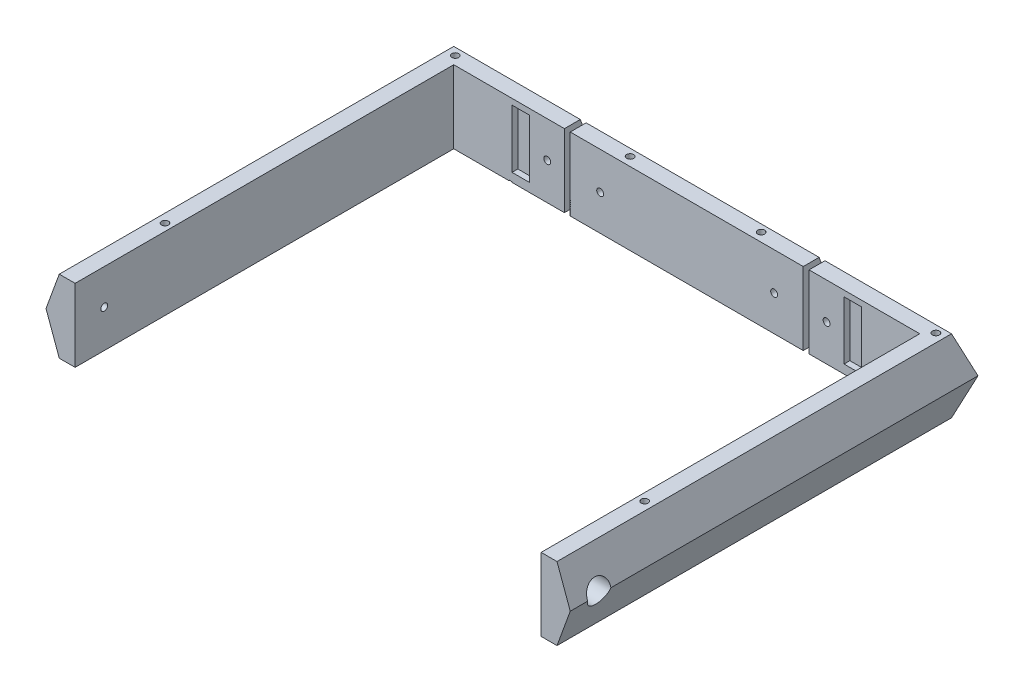
from build123d import *

# Parameters (mm, degrees)
BOSS_EXTRUDE1_DEPTH            = 31.75
SKETCH2_W                      = 1.348886442
SKETCH2_H                      = 0.254
CUT_EXTRUDE1_DEPTH             = 2.54
SKETCH19_W                     = 7.62
SKETCH19_H                     = 25.4
CUT_EXTRUDE5_DEPTH             = 2.54
SKETCH3_W                      = 101.6
SKETCH3_H                      = 12.7
BOSS_EXTRUDE2_DEPTH            = 31.75
CHAMFER4_SIZE                  = 15.875
CHAMFER4_SIZE2                 = 5.778027469
CHAMFER5_SIZE                  = 15.875
CHAMFER5_SIZE_2                = 5.778027469
CHAMFER6_SIZE                  = 15.875
CHAMFER6_SIZE2                 = 5.778027469
CHAMFER7_SIZE                  = 15.875
CHAMFER7_SIZE_2                = 5.778027469
CHAMFER8_SIZE                  = 15.875
CHAMFER8_SIZE2                 = 5.778027469
CHAMFER9_SIZE                  = 15.875
CHAMFER9_SIZE_2                = 5.778027469
CHAMFER10_SIZE                 = 15.875
CHAMFER10_SIZE2                = 5.778027469
CHAMFER11_SIZE2                = 5.778027469
CHAMFER11_SIZE                 = 15.875
CHAMFER12_SIZE                 = 15.875
CHAMFER12_SIZE2                = 5.778027469
CHAMFER13_SIZE2                = 5.778027469
CHAMFER13_SIZE                 = 15.875
CUT_EXTRUDE2_START             = 2.54
SKETCH4_R                      = 5.08
CUT_EXTRUDE2_DEPTH             = 25.4
CUT_EXTRUDE3_START             = 2.54
SKETCH5_R                      = 5.147895679
SKETCH5_R_2                    = 5.08
CUT_EXTRUDE3_DEPTH             = 25.4
CUT_EXTRUDE4_START             = -2.54
SKETCH6_R                      = 5.08
CUT_EXTRUDE4_DEPTH             = 12.7
F_3_0MM_DOWEL_HOLE3_AT_2_COUNT = 2
F_3_0MM_DOWEL_HOLE3_AT_2_PITCH = 23.068947374
F_3_0MM_START                  = -2.54
F_3_0MM_DOWEL_HOLE4_OUTLINE_R  = 1.5
F_3_0MM_DOWEL_HOLE4_DEPTH      = 2.54


# Read off the part's stored shape, not the designer's step: Ø3.0mm Dowel Hole4, Ø3.0mm Dowel Hole5, Ø3.0mm Dowel Hole6
# Some blends are built 0.0001 mm under size
with BuildPart() as part:
    # Sketch1 → Boss-Extrude1 (new body)
    with BuildSketch(Plane(origin=(0, 0, 0), x_dir=(1, 0, 0), z_dir=(0, 1, 0))):
        Polygon((-101.6, 0), (-101.6, -165.1), (-114.3, -165.1), (-114.3, 12.7), (-53.34, 12.7), (-53.34, 0), align=None)
    extrude(amount=BOSS_EXTRUDE1_DEPTH)

    # Sketch2 → Cut-Extrude1 (cut)
    with BuildSketch(Plane.XY):
        with Locations((-76.874443221, 0.127)):
            Rectangle(SKETCH2_W, SKETCH2_H)
    extrude(amount=-CUT_EXTRUDE1_DEPTH, mode=Mode.SUBTRACT)


with BuildPart() as body_2:
    # Mirror4: mirrored copy
    add(part.part.mirror(Plane(origin=(0, 0, 0), x_dir=(0, 0, 1), z_dir=(1, 0, 0))))

    # Sketch19 → Cut-Extrude5 (cut)
    with BuildSketch(Plane.XY):
        with Locations((72.39, 16.51)):
            Rectangle(SKETCH19_W, SKETCH19_H)
    cut_extrude5 = extrude(amount=-CUT_EXTRUDE5_DEPTH, mode=Mode.SUBTRACT)

    # Chamfer8
    chamfer8_edges = [body_2.edges().sort_by_distance(p)[0] for p in [
        (114.3, 31.75, 76.2),
    ]]
    chamfer8_side = [body_2.faces().sort_by_distance(p)[0] for p in [
        (114.3, 15.875, 76.2),
    ]]
    chamfer(chamfer8_edges, length=CHAMFER8_SIZE, length2=CHAMFER8_SIZE2, reference=chamfer8_side[0])

    # Chamfer9
    # the kernel refuses this chamfer: 15.875, 5.778027469 mm, written as the material it takes off along each edge
    with BuildSketch(Plane(origin=(114.3, 0, 206.282841379), x_dir=(0.013184058198645545, 0.9999130865277317, 0), z_dir=(0, 0, -1))) as chamfer9_piece_1:
        Polygon((CHAMFER9_SIZE * 0.999913086528, -CHAMFER9_SIZE * 0.0131840581986), (-CHAMFER9_SIZE_2 * 0.0131840581986, -CHAMFER9_SIZE_2 * 0.999913086524), (0, 0), align=None)
    extrude(amount=260.165682758, mode=Mode.SUBTRACT)

    # Chamfer10
    chamfer10_edges = [body_2.edges().sort_by_distance(p)[0] for p in [
        (80.930986266, 31.75, -12.7),
    ]]
    chamfer10_side = [body_2.faces().sort_by_distance(p)[0] for p in [
        (82.399447724, 15.875, -12.7),
    ]]
    chamfer(chamfer10_edges, length=CHAMFER10_SIZE, length2=CHAMFER10_SIZE2, reference=chamfer10_side[0])

    # Chamfer11
    chamfer11_edges = [body_2.edges().sort_by_distance(p)[0] for p in [
        (80.930986266, 0, -12.7),
    ]]
    chamfer11_side = [body_2.faces().sort_by_distance(p)[0] for p in [
        (80.930986266, 0.115560549, -12.7),
    ]]
    chamfer(chamfer11_edges, length=CHAMFER11_SIZE - 0.0001, length2=CHAMFER11_SIZE2 - 0.0001, reference=chamfer11_side[0])  # a hair under: the kernel refuses the full size

    # Sketch4 → Cut-Extrude2 (cut)
    with BuildSketch(Plane(origin=(-76.2, 0, 0), x_dir=(-1, 0, 0), z_dir=(0, 0, -1)).offset(CUT_EXTRUDE2_START)):
        with Locations((-137.16, 15.875)):
            Circle(SKETCH4_R)
    cut_extrude2 = extrude(amount=CUT_EXTRUDE2_DEPTH, mode=Mode.SUBTRACT)

    # Sketch6 → Cut-Extrude4 (cut)
    with BuildSketch(Plane.ZY.offset(-101.6).offset(CUT_EXTRUDE4_START)):
        with Locations((152.4, 16.401907221)):
            Circle(SKETCH6_R)
    cut_extrude4 = extrude(amount=-CUT_EXTRUDE4_DEPTH, mode=Mode.SUBTRACT)

    # Sketch8 → Hole Wizard 2736 (revolve, cut)
    with BuildSketch(Plane(origin=(104.14, 16.401907221, 152.4), x_dir=(0, 0, -1), z_dir=(0, 1, 0))):
        Polygon((0, 0), (0, 8.521290929), (1.5, 7.62), (1.5, 0), align=None)
    revolve(axis=Axis((110.49, 16.401907221, 152.4), (-1, 0, 0)), mode=Mode.SUBTRACT)

    # Sketch12 → Ø3.0mm Dowel Hole1 (revolve, cut)
    with BuildSketch(Plane(origin=(60.96, 15.875, -2.54), x_dir=(0, 1, 0), z_dir=(1, 0, 0))):
        Polygon((0, 0), (0, 5.981290929), (1.5, 5.08), (1.5, 0), align=None)
    revolve(axis=Axis((60.96, 15.875, -8.89), (0, 0, 1)), mode=Mode.SUBTRACT)

    # 3.0mm Dowel Hole5 3 outline → 3.0mm Dowel Hole5 3 (revolve, cut)
    with BuildSketch(Plane(origin=(104.838027469, 0, -3.81), x_dir=(1, 0, 0), z_dir=(0, 0, 1))):
        Polygon((0, 31.75), (0, 27.356209071), (1.5, 28.2575), (1.5, 31.75), align=None)
    revolve(axis=Axis((104.838027469, 0, -3.81), (0, 1, 0)), mode=Mode.SUBTRACT)

    # 3.0mm Dowel Hole5 4 outline → 3.0mm Dowel Hole5 4 (revolve, cut)
    with BuildSketch(Plane(origin=(104.838027469, 0, 123.19), x_dir=(1, 0, 0), z_dir=(0, 0, 1))):
        Polygon((0, 31.75), (0, 27.356209071), (1.5, 28.2575), (1.5, 31.75), align=None)
    revolve(axis=Axis((104.838027469, 0, 123.19), (0, 1, 0)), mode=Mode.SUBTRACT)

    # 3.0mm Dowel Hole6 3 outline → 3.0mm Dowel Hole6 3 (revolve, cut)
    with BuildSketch(Plane(origin=(104.838027469, 0, -3.111972531), x_dir=(1, 0, 0), z_dir=(0, 0, 1))):
        Polygon((1.5, 0), (1.5, 3.4925), (0, 4.393790929), (0, 0), align=None)
    revolve(axis=Axis((104.838027469, 0, -3.111972531), (0, 1, 0)), mode=Mode.SUBTRACT)

    # 3.0mm Dowel Hole6 4 outline → 3.0mm Dowel Hole6 4 (revolve, cut)
    with BuildSketch(Plane(origin=(104.838027469, 0, 123.888027469), x_dir=(1, 0, 0), z_dir=(0, 0, 1))):
        Polygon((1.5, 0), (1.5, 3.4925), (0, 4.393790929), (0, 0), align=None)
    revolve(axis=Axis((104.838027469, 0, 123.888027469), (0, 1, 0)), mode=Mode.SUBTRACT)


with BuildPart() as body_3:
    # Sketch3 → Boss-Extrude2 (new body)
    with BuildSketch(Plane(origin=(0, 0, 0), x_dir=(1, 0, 0), z_dir=(0, 1, 0))):
        with Locations((0, 6.35)):
            Rectangle(SKETCH3_W, SKETCH3_H)
    extrude(amount=BOSS_EXTRUDE2_DEPTH)

    # Chamfer4
    chamfer4_edges = [body_3.edges().sort_by_distance(p)[0] for p in [
        (0, 31.75, -12.7),
    ]]
    chamfer4_side = [body_3.faces().sort_by_distance(p)[0] for p in [
        (0, 15.875, -12.7),
    ]]
    chamfer(chamfer4_edges, length=CHAMFER4_SIZE, length2=CHAMFER4_SIZE2, reference=chamfer4_side[0])

    # Chamfer5
    # the kernel refuses this chamfer: 15.875, 5.778027469 mm, written as the material it takes off along each edge
    with BuildSketch(Plane(origin=(91.982841379, 0, -12.7), x_dir=(0, 0.9999130865277315, -0.013184058198645866), z_dir=(-1, 0, 0))) as chamfer5_piece_1:
        Polygon((CHAMFER5_SIZE * 0.999913086528, -CHAMFER5_SIZE * 0.0131840581986), (-CHAMFER5_SIZE_2 * 0.0131840581986, -CHAMFER5_SIZE_2 * 0.999913086524), (0, 0), align=None)
    extrude(amount=183.965682758, mode=Mode.SUBTRACT)

    # Sketch5 → Cut-Extrude3 (cut)
    with BuildSketch(Plane(origin=(-76.2, 0, 0), x_dir=(-1, 0, 0), z_dir=(0, 0, -1)).offset(CUT_EXTRUDE3_START)):
        with Locations(Location((-114.3, 15.363866424, 0), (0, 0, 174.301724033))):
            Circle(SKETCH5_R)
        with Locations(Location((-38.1, 15.363866424, 0), (0, 0, 174.225307714))):
            Circle(SKETCH5_R_2)
    extrude(amount=CUT_EXTRUDE3_DEPTH, mode=Mode.SUBTRACT)

    # Sketch15 → Ø3.0mm Dowel Hole3 (revolve, cut)
    with BuildSketch(Plane(origin=(-37.760805084, 15.502033877, -2.54), x_dir=(0, 1, 0), z_dir=(1, 0, 0))):
        Polygon((0, 0), (0, 13.601290929), (1.5, 12.7), (1.5, 0), align=None)
    f_3_0mm_dowel_hole3 = revolve(axis=Axis((-37.760805084, 15.502033877, -8.89), (0, 0, 1)), mode=Mode.SUBTRACT)

    # Ø3.0mm Dowel Hole4 outline → Ø3.0mm Dowel Hole4 (cut)
    with BuildSketch(Plane.XY.offset(F_3_0MM_START)):
        with Locations((38.1, 15.363866424)):
            Circle(F_3_0MM_DOWEL_HOLE4_OUTLINE_R)
    extrude(amount=F_3_0MM_DOWEL_HOLE4_DEPTH, mode=Mode.SUBTRACT)

    # Ø3.0mm Dowel Hole5 outline → Ø3.0mm Dowel Hole5 (revolve, cut)
    with BuildSketch(Plane(origin=(-28.511972531, 0, -3.81), x_dir=(1, 0, 0), z_dir=(0, 0, 1))):
        Polygon((0, 31.75), (0, 27.356209071), (1.5, 28.2575), (1.5, 31.75), align=None)
    revolve(axis=Axis((-28.511972531, 0, -3.81), (0, 1, 0)), mode=Mode.SUBTRACT)

    # 3.0mm Dowel Hole5 2 outline → 3.0mm Dowel Hole5 2 (revolve, cut)
    with BuildSketch(Plane(origin=(28.638027469, 0, -3.81), x_dir=(1, 0, 0), z_dir=(0, 0, 1))):
        Polygon((0, 31.75), (0, 27.356209071), (1.5, 28.2575), (1.5, 31.75), align=None)
    revolve(axis=Axis((28.638027469, 0, -3.81), (0, 1, 0)), mode=Mode.SUBTRACT)

    # Ø3.0mm Dowel Hole6 outline → Ø3.0mm Dowel Hole6 (revolve, cut)
    with BuildSketch(Plane(origin=(28.638027469, 0, -3.111972531), x_dir=(1, 0, 0), z_dir=(0, 0, 1))):
        Polygon((1.5, 3.4925), (0, 4.393790929), (0, 0), (1.5, 0), align=None)
    revolve(axis=Axis((28.638027469, 0, -3.111972531), (0, 1, 0)), mode=Mode.SUBTRACT)

    # 3.0mm Dowel Hole6 2 outline → 3.0mm Dowel Hole6 2 (revolve, cut)
    with BuildSketch(Plane(origin=(-28.511972531, 0, -3.111972531), x_dir=(1, 0, 0), z_dir=(0, 0, 1))):
        Polygon((1.5, 3.4925), (0, 4.393790929), (0, 0), (1.5, 0), align=None)
    revolve(axis=Axis((-28.511972531, 0, -3.111972531), (0, 1, 0)), mode=Mode.SUBTRACT)


with BuildPart() as part_1:
    add(part.part)

    # Chamfer6
    chamfer6_edges = [part_1.edges().sort_by_distance(p)[0] for p in [
        (-114.3, 31.75, 76.2),
    ]]
    chamfer6_side = [part_1.faces().sort_by_distance(p)[0] for p in [
        (-114.3, 15.875, 76.2),
    ]]
    chamfer(chamfer6_edges, length=CHAMFER6_SIZE, length2=CHAMFER6_SIZE2, reference=chamfer6_side[0])

    # Chamfer7
    # the kernel refuses this chamfer: 15.875, 5.778027469 mm, written as the material it takes off along each edge
    with BuildSketch(Plane(origin=(-114.3, 0, 206.282841379), x_dir=(-0.013184058198645545, 0.9999130865277317, 0), z_dir=(0, 0, -1))) as chamfer7_piece_1:
        Polygon((CHAMFER7_SIZE * 0.999913086528, CHAMFER7_SIZE * 0.0131840581986), (-CHAMFER7_SIZE_2 * 0.0131840581986, CHAMFER7_SIZE_2 * 0.999913086524), (0, 0), align=None)
    extrude(amount=260.165682758, mode=Mode.SUBTRACT)

    # Chamfer12
    chamfer12_edges = [part_1.edges().sort_by_distance(p)[0] for p in [
        (-80.930986266, 31.75, -12.7),
    ]]
    chamfer12_side = [part_1.faces().sort_by_distance(p)[0] for p in [
        (-82.399447724, 15.875, -12.7),
    ]]
    chamfer(chamfer12_edges, length=CHAMFER12_SIZE, length2=CHAMFER12_SIZE2, reference=chamfer12_side[0])

    # Chamfer13
    chamfer13_edges = [part_1.edges().sort_by_distance(p)[0] for p in [
        (-80.930986266, 0, -12.7),
    ]]
    chamfer13_side = [part_1.faces().sort_by_distance(p)[0] for p in [
        (-80.930986266, 0.115560549, -12.7),
    ]]
    chamfer(chamfer13_edges, length=CHAMFER13_SIZE - 0.0001, length2=CHAMFER13_SIZE2 - 0.0001, reference=chamfer13_side[0])  # a hair under: the kernel refuses the full size

    # Mirror5: Cut-Extrude2 across plane
    add(cut_extrude2.mirror(Plane(origin=(0, 0, 0), x_dir=(0, 0, 1), z_dir=(1, 0, 0))), mode=Mode.SUBTRACT)

    # Mirror7: Cut-Extrude4 across plane
    add(cut_extrude4.mirror(Plane(origin=(0, 0, 0), x_dir=(0, 0, 1), z_dir=(1, 0, 0))), mode=Mode.SUBTRACT)

    # Sketch10 → Hole Wizard 2871 (revolve, cut)
    with BuildSketch(Plane(origin=(-104.14, 16.401907221, 152.4), x_dir=(0, 0, 1), z_dir=(0, 1, 0))):
        Polygon((0, 0), (0, 8.521290929), (1.5, 7.62), (1.5, 0), align=None)
    revolve(axis=Axis((-110.49, 16.401907221, 152.4), (1, 0, 0)), mode=Mode.SUBTRACT)

    # Ø3.0mm Dowel Hole3 at 2: Ø3.0mm Dowel Hole3 ×2
    with Locations(*[Vector(-0.9997387915498553, 0.022854948489000708, 0) * (i * F_3_0MM_DOWEL_HOLE3_AT_2_PITCH) for i in range(1, F_3_0MM_DOWEL_HOLE3_AT_2_COUNT)]):
        add(f_3_0mm_dowel_hole3, mode=Mode.SUBTRACT)

    # 3.0mm Dowel Hole5 5 outline → 3.0mm Dowel Hole5 5 (revolve, cut)
    with BuildSketch(Plane(origin=(-104.741464941, 0, 122.765456434), x_dir=(1, 0, 0), z_dir=(0, 0, 1))):
        Polygon((0, 31.75), (0, 25.768709071), (1.5, 26.67), (1.5, 31.75), align=None)
    revolve(axis=Axis((-104.741464941, 0, 122.765456434), (0, 1, 0)), mode=Mode.SUBTRACT)

    # 3.0mm Dowel Hole5 6 outline → 3.0mm Dowel Hole5 6 (revolve, cut)
    with BuildSketch(Plane(origin=(-104.711972531, 0, -3.81), x_dir=(1, 0, 0), z_dir=(0, 0, 1))):
        Polygon((0, 31.75), (0, 27.356209071), (1.5, 28.2575), (1.5, 31.75), align=None)
    revolve(axis=Axis((-104.711972531, 0, -3.81), (0, 1, 0)), mode=Mode.SUBTRACT)

    # 3.0mm Dowel Hole6 5 outline → 3.0mm Dowel Hole6 5 (revolve, cut)
    with BuildSketch(Plane(origin=(-104.711972531, 0, -3.111972531), x_dir=(1, 0, 0), z_dir=(0, 0, 1))):
        Polygon((1.5, 0), (1.5, 3.4925), (0, 4.393790929), (0, 0), align=None)
    revolve(axis=Axis((-104.711972531, 0, -3.111972531), (0, 1, 0)), mode=Mode.SUBTRACT)

    # 3.0mm Dowel Hole6 6 outline → 3.0mm Dowel Hole6 6 (revolve, cut)
    with BuildSketch(Plane(origin=(-104.711972531, 0, 123.888027469), x_dir=(1, 0, 0), z_dir=(0, 0, 1))):
        Polygon((1.5, 0), (1.5, 3.4925), (0, 4.393790929), (0, 0), align=None)
    revolve(axis=Axis((-104.711972531, 0, 123.888027469), (0, 1, 0)), mode=Mode.SUBTRACT)

    # Mirror8: Cut-Extrude5 across plane
    add(cut_extrude5.mirror(Plane(origin=(0, 0, 0), x_dir=(0, 0, 1), z_dir=(1, 0, 0))), mode=Mode.SUBTRACT)


solid = Compound([body_2.part, body_3.part, part_1.part])
